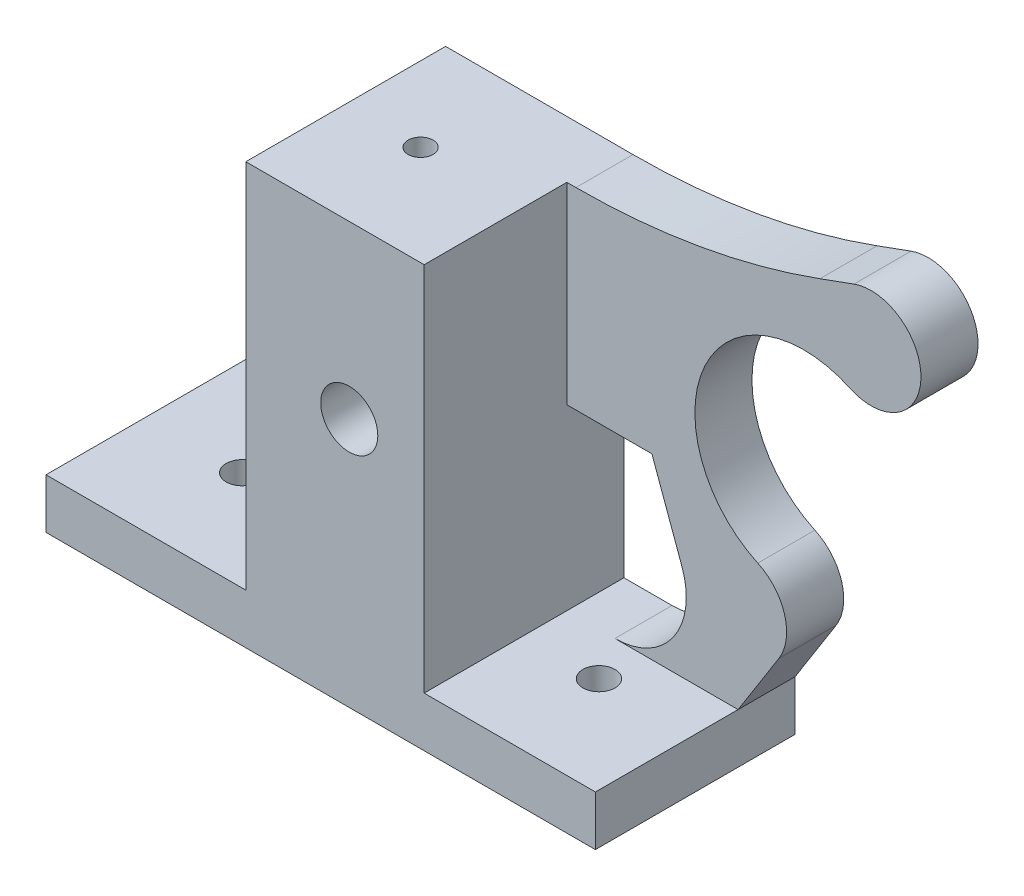
from build123d import *

# Parameters (mm, degrees)
SKETCH5_R           = 4
BOSS_EXTRUDE1_DEPTH = 8
SKETCH6_R           = 4
BOSS_EXTRUDE2_DEPTH = 20
SKETCH7_R           = 7.875
CUT_EXTRUDE1_DEPTH  = 4
SKETCH8_R           = 1.75
CUT_EXTRUDE2_DEPTH  = 64
SKETCH9_R           = 2.25
CUT_EXTRUDE3_DEPTH  = 64
FILLET1_R           = 10
FILLET2_R           = 100


with BuildPart() as part:
    # Sketch5 → Boss-Extrude1 (new body)
    with BuildSketch(Plane.XY):
        with BuildLine():
            Line((-39.50246281, 0), (37.49753719, 0))
            Line((37.49753719, 0), (37.49753719, 7))
            Line((37.49753719, 7), (43.222743941, 16.079315214))
            ThreePointArc((43.222743941, 16.079315214), (44.02651236, 17.869791646), (44.301644469, 19.813023965))
            ThreePointArc((44.301644469, 19.813023965), (43.205384589, 23.574121224), (40.259972301, 26.157178474))
            ThreePointArc((40.259972301, 26.157178474), (32.872164463, 46.455013688), (53.169999677, 53.842821526))
            ThreePointArc((53.169999677, 53.842821526), (63.12166506, 59.881640323), (53.734186506, 66.76482438))
            Line((53.734186506, 66.76482438), (32.400506855, 59))
            Line((32.400506855, 59), (-11.5, 59))
            Line((-11.5, 59), (-11.5, 7))
            Line((-11.5, 7), (-39.50246281, 7))
            Line((-39.50246281, 7), (-39.50246281, 0))
        make_face()
        Polygon((34.515959396, 7), (13.5, 7), (13.5, 32), (25.416703539, 32), align=None, mode=Mode.SUBTRACT)
        with Locations((3, 35)):
            Circle(SKETCH5_R, mode=Mode.SUBTRACT)
    extrude(amount=BOSS_EXTRUDE1_DEPTH)

    # Sketch6 → Boss-Extrude2 (add)
    with BuildSketch(Plane.XY.offset(8)):
        Polygon((37.49753719, 0), (-39.50246281, 0), (-39.50246281, 7), (-11.5, 7), (-11.5, 59), (13.5, 59), (13.5, 7), (37.49753719, 7), align=None)
        with Locations((3, 35)):
            Circle(SKETCH6_R, mode=Mode.SUBTRACT)
    extrude(amount=BOSS_EXTRUDE2_DEPTH)

    # Sketch7 → Cut-Extrude1 (cut)
    with BuildSketch(Plane.XZ):
        with Locations((-1.00246281, 14)):
            Circle(SKETCH7_R)
    extrude(amount=-CUT_EXTRUDE1_DEPTH, mode=Mode.SUBTRACT)

    # Sketch8 → Cut-Extrude2 (cut)
    with BuildSketch(Plane(origin=(0, 59, 0), x_dir=(1, 0, 0), z_dir=(0, 1, 0))):
        with Locations((-1.00246281, -14)):
            Circle(SKETCH8_R)
    extrude(amount=-CUT_EXTRUDE2_DEPTH, mode=Mode.SUBTRACT)

    # Sketch9 → Cut-Extrude3 (cut)
    with BuildSketch(Plane.XZ):
        with Locations((23.99753719, 14)):
            Circle(SKETCH9_R)
        with Locations((-26.00246281, 14)):
            Circle(SKETCH9_R)
    extrude(amount=-CUT_EXTRUDE3_DEPTH, mode=Mode.SUBTRACT)

    # Fillet1
    fillet1_edges = [part.edges().sort_by_distance(p)[0] for p in [
        (34.515959396, 7, 4),
    ]]
    fillet(fillet1_edges, radius=FILLET1_R)

    # Fillet2
    fillet2_edges = [part.edges().sort_by_distance(p)[0] for p in [
        (32.400506855, 59, 4),
    ]]
    fillet(fillet2_edges, radius=FILLET2_R)


solid = part.part
